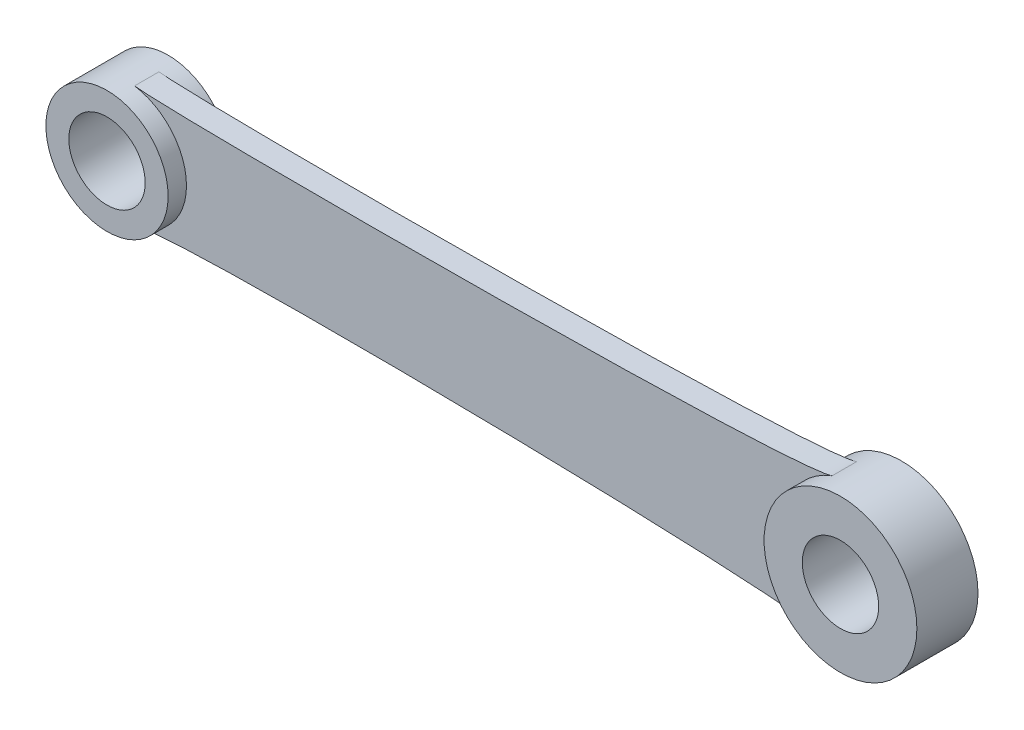
from build123d import *

# Parameters (mm, degrees)
BOSS_EXTRUDE1_START = -4
BOSS_EXTRUDE1_DEPTH = 8
SKETCH4_R           = 20
SKETCH4_R_2         = 12.5
SKETCH4_R_3         = 25
BOSS_EXTRUDE5_DEPTH = 10


# Read off the part's stored shape, not the designer's step: Boss-Extrude1
with BuildPart() as part:
    # Boss-Extrude1 outline → Boss-Extrude1 (new body)
    with BuildSketch(Plane.XY.offset(BOSS_EXTRUDE1_START)):
        with BuildLine():
            add(Edge.make_bspline(
                [(3.005567425, 19.772874461), (18.916222227, 17.720110762), (215.876421889, 18.298562521), (231.273379323, 23.427464471)],
                knots=[0.02790249, 0.02790249, 0.02790249, 0.02790249, 0.919000917, 0.919000917, 0.919000917, 0.919000917], degree=3))
            ThreePointArc((3.005567425, 19.772874461), (19.964927421, 1.183922747), (5.321353729, -19.279086973))
            add(Edge.make_bspline(
                [(5.321353729, -19.279086973), (29.380163277, -15.107768003), (216.311047881, -18.024838758), (231.401749268, -23.474881988)],
                knots=[0.059243279, 0.059243279, 0.059243279, 0.059243279, 0.920155583, 0.920155583, 0.920155583, 0.920155583], degree=3))
            ThreePointArc((231.401749268, -23.474881988), (215.000093636, -0.068423797), (231.273379323, 23.427464471))
        make_face()
    extrude(amount=BOSS_EXTRUDE1_DEPTH)

    # Sketch4 → Boss-Extrude5 (add, symmetric)
    # profile 1 of 2: a face of its own
    with BuildSketch(Plane.XY):
        Circle(SKETCH4_R)
        Circle(SKETCH4_R_2, mode=Mode.SUBTRACT)
    # profile 2 of 2: a face of its own
    with BuildSketch(Plane.XY):
        with Locations((240, 0)):
            Circle(SKETCH4_R_3)
        with Locations((240, 0)):
            Circle(SKETCH4_R_2, mode=Mode.SUBTRACT)
    extrude(amount=BOSS_EXTRUDE5_DEPTH, both=True)


solid = part.part
